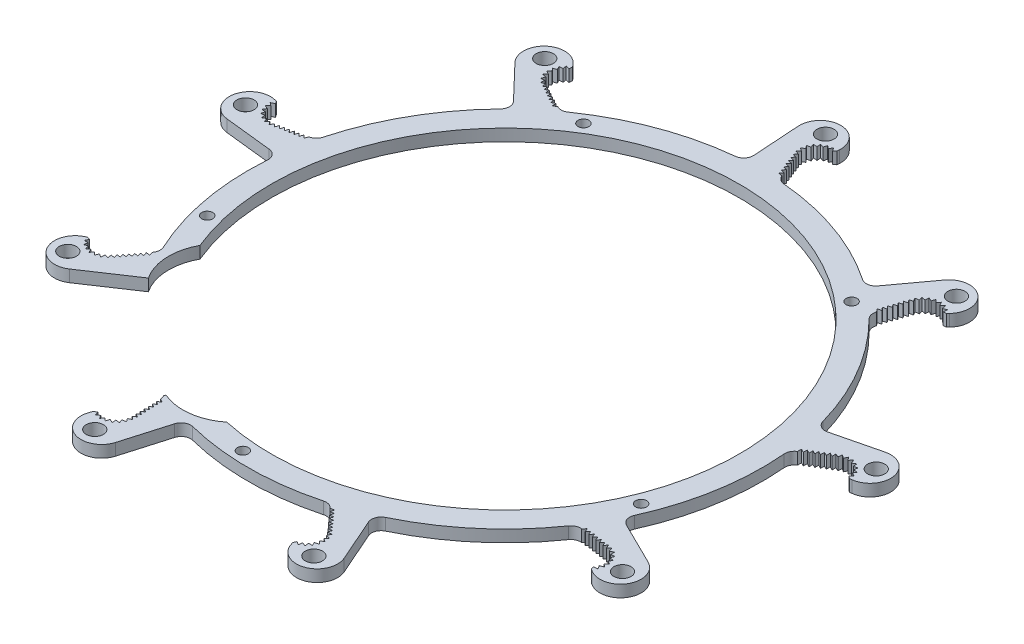
from build123d import *

# Parameters (mm, degrees)
SKETCH1_R           = 68.58
SKETCH1_R_2         = 55.88
BOSS_EXTRUDE1_DEPTH = 3.175
BOSS_EXTRUDE2_START = -3.175
BOSS_EXTRUDE2_DEPTH = 3.175
CIRPATTERN1_COUNT   = 9
SKETCH4_R           = 1.27
CUT_EXTRUDE1_DEPTH  = 126.612114435
CIRPATTERN14_COUNT  = 4
SKETCH5_R           = 62.357
CUT_EXTRUDE2_DEPTH  = 126.612114435
CUT_EXTRUDE3_DEPTH  = 126.612114435
SKETCH7_R           = 1.4605
CUT_EXTRUDE4_DEPTH  = 126.612114435
CIRPATTERN15_COUNT  = 5
CUT_EXTRUDE5_DEPTH  = 126.612114435
CRVPATTERN1_DEPTH   = 3.175
CIRPATTERN16_COUNT  = 9
CUT_EXTRUDE6_DEPTH  = 126.612114435
SKETCH3_R           = 2.286
CUT_EXTRUDE7_DEPTH  = 126.612114435
CIRPATTERN17_COUNT  = 9


# Read off the part's stored shape, not the designer's step: CrvPattern1
with BuildPart() as part:
    # Sketch1 → Boss-Extrude1 (new body)
    with BuildSketch(Plane(origin=(0, 0, 0), x_dir=(1, 0, 0), z_dir=(0, 1, 0))):
        with Locations(Location((0, 0, 0), (0, 0, 270))):
            Circle(SKETCH1_R)
        with Locations(Location((0, 0, 0), (0, 0, 270))):
            Circle(SKETCH1_R_2, mode=Mode.SUBTRACT)
    extrude(amount=BOSS_EXTRUDE1_DEPTH)

    # Sketch2 → Boss-Extrude2 (add)
    with BuildSketch(Plane(origin=(0, 3.175, 0), x_dir=(1, 0, 0), z_dir=(0, 1, 0)).offset(BOSS_EXTRUDE2_START)):
        with BuildLine():
            Line((-4.648503105, 70.922452149), (-5.395010683, 82.311956847))
            Line((-5.395010683, 82.311956847), (-5.478072657, 83.579237679))
            ThreePointArc((-5.478072657, 83.579237679), (0, 89.428116328), (5.478072657, 83.579237679))
            Line((5.478072657, 83.579237679), (5.395010683, 82.311956847))
            ThreePointArc((5.395010683, 82.311956847), (1.617293808, 81.120206155), (0.93984527, 77.217325427))
            Line((0.93984527, 77.217325427), (3.81, 69.921657137))
            ThreePointArc((3.81, 69.921657137), (4.653834894, 68.816417694), (5.953179428, 68.321124513))
            ThreePointArc((5.953179428, 68.321124513), (-0.488833742, 68.57825779), (-6.926526743, 68.22931648))
            ThreePointArc((-6.926526743, 68.22931648), (-5.243785443, 69.115963701), (-4.648503105, 70.922452149))
        make_face()
    boss_extrude2 = extrude(amount=BOSS_EXTRUDE2_DEPTH)

    # CirPattern1: Boss-Extrude2 ×9 about axis
    cirpattern1_axis = Axis((0, 0, 0), (0, 1, 0))
    for i in range(1, CIRPATTERN1_COUNT):
        add(boss_extrude2.rotate(cirpattern1_axis, i * 360 / CIRPATTERN1_COUNT))

    # Sketch4 → Cut-Extrude1 (cut, through all)
    with BuildSketch(Plane(origin=(0, 3.175, 0), x_dir=(1, 0, 0), z_dir=(0, 1, 0))):
        with Locations(Location((53.522006363, 24.957721447, 0), (0, 0, 270))):
            Circle(SKETCH4_R)
    cut_extrude1 = extrude(amount=-CUT_EXTRUDE1_DEPTH, mode=Mode.SUBTRACT)

    # CirPattern14: Cut-Extrude1 ×4 about axis
    cirpattern14_axis = Axis((0, 0, 0), (0, 1, 0))
    for i in range(1, CIRPATTERN14_COUNT):
        add(cut_extrude1.rotate(cirpattern14_axis, i * 360 / CIRPATTERN14_COUNT), mode=Mode.SUBTRACT)

    # Sketch5 → Cut-Extrude2 (cut, through all)
    with BuildSketch(Plane(origin=(0, 3.175, 0), x_dir=(1, 0, 0), z_dir=(0, 1, 0))):
        with Locations(Location((0, 0, 0), (0, 0, 270))):
            Circle(SKETCH5_R)
    extrude(amount=-CUT_EXTRUDE2_DEPTH, mode=Mode.SUBTRACT)

    # Sketch6 → Cut-Extrude3 (cut, through all)
    with BuildSketch(Plane(origin=(0, 3.175, 0), x_dir=(1, 0, 0), z_dir=(0, 1, 0))):
        with BuildLine():
            Line((-59.096393707, -39.486947853), (-51.847950614, -34.64369302))
            ThreePointArc((-51.847950614, -34.64369302), (-40.082306977, -47.76823334), (-25.11407534, -57.076077903))
            Line((-25.11407534, -57.076077903), (-27.819131699, -63.223786127))
            ThreePointArc((-27.819131699, -63.223786127), (-28.307061162, -62.604548792), (-28.961359577, -62.164749267))
            ThreePointArc((-28.961359577, -62.164749267), (-43.70678603, -52.848209572), (-55.625057983, -40.113206359))
            ThreePointArc((-55.625057983, -40.113206359), (-57.234287651, -39.099233257), (-59.096393707, -39.486947853))
        make_face()
    extrude(amount=-CUT_EXTRUDE3_DEPTH, mode=Mode.SUBTRACT)

    # Sketch7 → Cut-Extrude4 (cut, through all)
    with BuildSketch(Plane(origin=(0, 3.175, 0), x_dir=(1, 0, 0), z_dir=(0, 1, 0))):
        with Locations(Location((42.123157638, 50.200424446, 0), (0, 0, 270))):
            Circle(SKETCH7_R)
    cut_extrude4 = extrude(amount=-CUT_EXTRUDE4_DEPTH, mode=Mode.SUBTRACT)

    # CirPattern15: Cut-Extrude4 ×5 about axis
    cirpattern15_axis = Axis((0, 0, 0), (0, 1, 0))
    for i in range(1, CIRPATTERN15_COUNT):
        add(cut_extrude4.rotate(cirpattern15_axis, i * 360 / CIRPATTERN15_COUNT), mode=Mode.SUBTRACT)

    # Sketch9 → Cut-Extrude5 (cut, through all)
    with BuildSketch(Plane(origin=(0, 3.175, 0), x_dir=(1, 0, 0), z_dir=(0, 1, 0))):
        Polygon((3.492302411, 71.076120273), (2.779305238, 70.113251627), (3.957242109, 69.894286496), align=None)
    cut_extrude5 = extrude(amount=-CUT_EXTRUDE5_DEPTH, mode=Mode.SUBTRACT)

    # CrvPattern1 outline → CrvPattern1 (cut)
    with BuildSketch(Plane(origin=(0, 0, 0), x_dir=(1, 0, 0), z_dir=(0, 1, 0))):
        with BuildLine():
            Line((0.940711797, 77.166791582), (0.329256214, 76.341050005))
            Line((0.329256214, 76.341050005), (1.359950976, 76.149455515))
            Line((1.359950976, 76.149455515), (0.93984527, 77.217325427))
            ThreePointArc((0.93984527, 77.217325427), (1.617293808, 81.120206155), (5.395010683, 82.311956847))
            Line((5.395010683, 82.311956847), (5.44100327, 83.013668123))
            Line((5.44100327, 83.013668123), (4.84878437, 82.438133766))
            Line((4.84878437, 82.438133766), (4.242655964, 83.304873176))
            Line((4.242655964, 83.304873176), (3.729171189, 82.380231497))
            Line((3.729171189, 82.380231497), (2.898698206, 83.03516926))
            Line((2.898698206, 83.03516926), (2.673905231, 82.001681492))
            Line((2.673905231, 82.001681492), (1.689757293, 82.389085266))
            Line((1.689757293, 82.389085266), (1.772785019, 81.334696701))
            Line((1.772785019, 81.334696701), (0.718708814, 81.421600119))
            Line((0.718708814, 81.421600119), (1.102491944, 80.436034617))
            Line((1.102491944, 80.436034617), (0.068184752, 80.215042577))
            Line((0.068184752, 80.215042577), (0.720065018, 79.382167456))
            Line((0.720065018, 79.382167456), (-0.206458139, 78.872085414))
            Line((-0.206458139, 78.872085414), (0.658047102, 78.262774707))
            Line((0.658047102, 78.262774707), (-0.081848948, 77.507008417))
            Line((-0.081848948, 77.507008417), (0.940711797, 77.166791582))
        make_face()
        Polygon((3.401658496, 70.959623533), (2.994836261, 71.993728089), (2.370963734, 71.151218023), align=None)
        Polygon((2.993316992, 71.99758993), (2.586494757, 73.031694485), (1.96262223, 72.189184419), align=None)
        Polygon((2.584975488, 73.035556326), (2.178153253, 74.069660882), (1.554280726, 73.227150816), align=None)
        Polygon((2.176633984, 74.073522723), (1.769811749, 75.107627278), (1.145939222, 74.265117212), align=None)
        Polygon((1.76829248, 75.111489119), (1.361470245, 76.145593674), (0.737597718, 75.303083609), align=None)
    crvpattern1 = extrude(amount=CRVPATTERN1_DEPTH, mode=Mode.SUBTRACT)

    # CirPattern16: Cut-Extrude5, CrvPattern1 ×9 about axis
    cirpattern16_axis = Axis((0, 0, 0), (0, 1, 0))
    add([cut_extrude5.rotate(cirpattern16_axis, i * 360 / CIRPATTERN16_COUNT) for i in range(1, CIRPATTERN16_COUNT)], mode=Mode.SUBTRACT)
    add([crvpattern1.rotate(cirpattern16_axis, i * 360 / CIRPATTERN16_COUNT) for i in range(1, CIRPATTERN16_COUNT)], mode=Mode.SUBTRACT)

    # Sketch10 → Cut-Extrude6 (cut, through all)
    with BuildSketch(Plane(origin=(0, 3.175, 0), x_dir=(1, 0, 0), z_dir=(0, 1, 0))):
        with BuildLine():
            ThreePointArc((-57.022186012, -38.10100658), (-59.361766839, -30.982323494), (-57.68632637, -23.678749945))
            ThreePointArc((-57.68632637, -23.678749945), (-40.082306977, -47.76823334), (-13.301891078, -60.921713229))
            ThreePointArc((-13.301891078, -60.921713229), (-20.203569748, -63.83995223), (-27.620367991, -62.772061238))
            ThreePointArc((-27.620367991, -62.772061238), (-44.082374272, -52.535327909), (-57.022186012, -38.10100658))
        make_face()
    extrude(amount=-CUT_EXTRUDE6_DEPTH, mode=Mode.SUBTRACT)

    # Sketch3 → Cut-Extrude7 (cut, through all)
    with BuildSketch(Plane(origin=(0, 3.175, 0), x_dir=(1, 0, 0), z_dir=(0, 1, 0))):
        with Locations(Location((0, 85.364116328, 0), (0, 0, 270))):
            Circle(SKETCH3_R)
    cut_extrude7 = extrude(amount=-CUT_EXTRUDE7_DEPTH, mode=Mode.SUBTRACT)

    # CirPattern17: Cut-Extrude7 ×9 about axis
    cirpattern17_axis = Axis((0, 0, 0), (0, 1, 0))
    for i in range(1, CIRPATTERN17_COUNT):
        add(cut_extrude7.rotate(cirpattern17_axis, i * 360 / CIRPATTERN17_COUNT), mode=Mode.SUBTRACT)


solid = part.part
